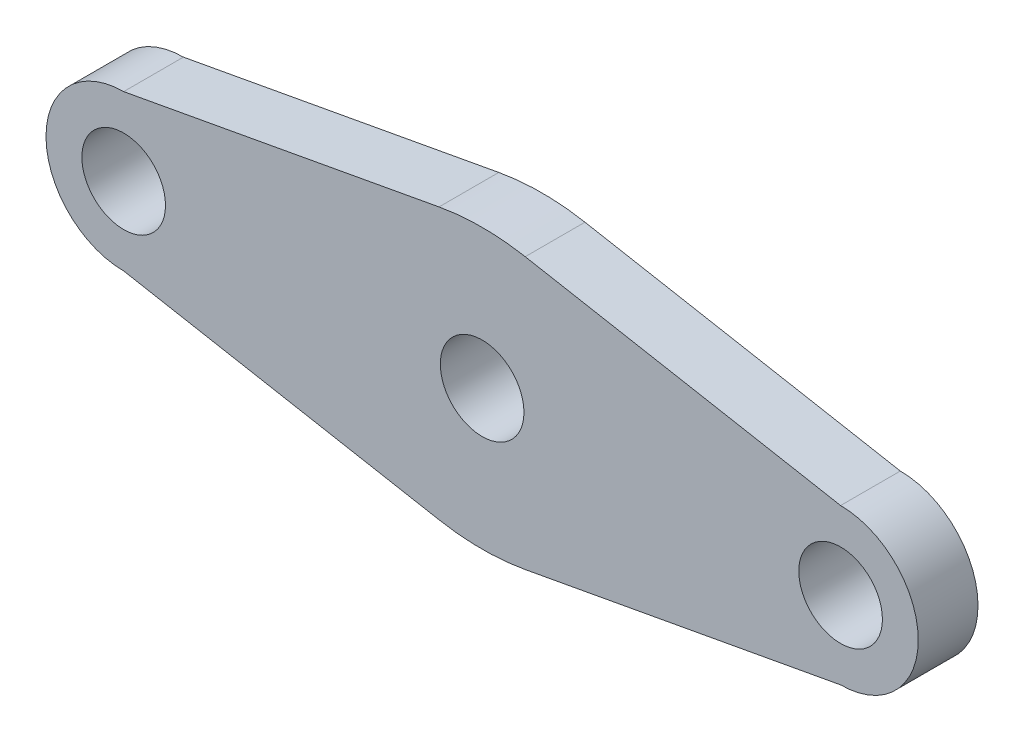
from build123d import *

# Parameters (mm, degrees)
SKETCH1_R           = 1.75
BOSS_EXTRUDE1_DEPTH = 2.5
FILLET1_R           = 10


with BuildPart() as part:
    # Sketch1 → Boss-Extrude1 (new body)
    with BuildSketch(Plane.XY):
        with BuildLine():
            ThreePointArc((-15, 3.25), (-18.25, 0), (-15, -3.25))
            Line((-15, -3.25), (0, -6))
            Line((0, -6), (15, -3.25))
            ThreePointArc((15, -3.25), (18.25, 0), (15, 3.25))
            Line((15, 3.25), (0, 6))
            Line((0, 6), (-15, 3.25))
        make_face()
        with Locations((-15, 0)):
            Circle(SKETCH1_R, mode=Mode.SUBTRACT)
        Circle(SKETCH1_R, mode=Mode.SUBTRACT)
        with Locations((15, 0)):
            Circle(SKETCH1_R, mode=Mode.SUBTRACT)
    extrude(amount=BOSS_EXTRUDE1_DEPTH)

    # Fillet1
    fillet1_edges = [part.edges().sort_by_distance(p)[0] for p in [
        (0, -6, 1.25),
        (0, 6, 1.25),
    ]]
    fillet(fillet1_edges, radius=FILLET1_R)


solid = part.part
